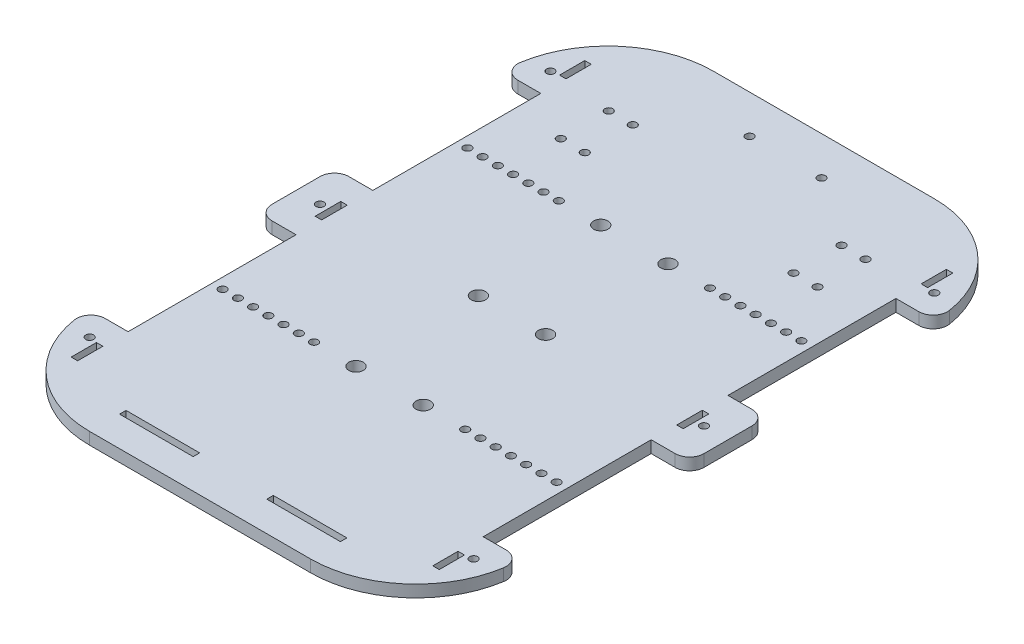
from build123d import *

# Parameters (mm, degrees)
SKETCH2_W           = 2.7
SKETCH2_H           = 10.51
SKETCH2_H_2         = 10.666666666
SKETCH2_W_2         = 30.68
SKETCH2_H_3         = 2.7
BOSS_EXTRUDE4_DEPTH = 5
SKETCH5_R           = 1.65
SKETCH5_R_2         = 3
CUT_EXTRUDE1_DEPTH  = 159.192920196


with BuildPart() as part:
    # Sketch2 → Boss-Extrude4 (new body)
    with BuildSketch(Plane(origin=(0, 0, 0), x_dir=(1, 0, 0), z_dir=(0, 1, 0))):
        with BuildLine():
            Line((46, -130), (-46, -130))
            ThreePointArc((-46, -130), (-74.550970119, -119.478980051), (-89.448061775, -92.947368421))
            ThreePointArc((-89.448061775, -92.947368421), (-88.08864154, -88.106685893), (-83.523326079, -86))
            Line((-83.523326079, -86), (-74, -86))
            Line((-74, -86), (-74, -16))
            Line((-74, -16), (-84, -16))
            ThreePointArc((-84, -16), (-88.242640687, -14.242640687), (-90, -10))
            Line((-90, -10), (-90, 10))
            ThreePointArc((-90, 10), (-88.242640687, 14.242640687), (-84, 16))
            Line((-84, 16), (-74, 16))
            Line((-74, 16), (-74, 86))
            Line((-74, 86), (-83.523326079, 86))
            ThreePointArc((-83.523326079, 86), (-88.08864154, 88.106685893), (-89.448061775, 92.947368421))
            ThreePointArc((-89.448061775, 92.947368421), (-74.550970119, 119.478980051), (-46, 130))
            Line((-46, 130), (46, 130))
            ThreePointArc((46, 130), (74.550970119, 119.478980051), (89.448061775, 92.947368421))
            ThreePointArc((89.448061775, 92.947368421), (88.08864154, 88.106685893), (83.523326079, 86))
            Line((83.523326079, 86), (74, 86))
            Line((74, 86), (74, 16))
            Line((74, 16), (84, 16))
            ThreePointArc((84, 16), (88.242640687, 14.242640687), (90, 10))
            Line((90, 10), (90, -10))
            ThreePointArc((90, -10), (88.242640687, -14.242640687), (84, -16))
            Line((84, -16), (74, -16))
            Line((74, -16), (74, -86))
            Line((74, -86), (83.523326079, -86))
            ThreePointArc((83.523326079, -86), (88.08864154, -88.106685893), (89.448061775, -92.947368421))
            ThreePointArc((89.448061775, -92.947368421), (74.550970119, -119.478980051), (46, -130))
        make_face()
        with Locations((-75.35, 101.765)):
            Rectangle(SKETCH2_W, SKETCH2_H, mode=Mode.SUBTRACT)
        with Locations((75.35, 101.765)):
            Rectangle(SKETCH2_W, SKETCH2_H, mode=Mode.SUBTRACT)
        with Locations((75.35, -101.765)):
            Rectangle(SKETCH2_W, SKETCH2_H, mode=Mode.SUBTRACT)
        with Locations((-75.35, -101.765)):
            Rectangle(SKETCH2_W, SKETCH2_H, mode=Mode.SUBTRACT)
        with Locations((-75.35, 0)):
            Rectangle(SKETCH2_W, SKETCH2_H_2, mode=Mode.SUBTRACT)
        with Locations((75.35, 0)):
            Rectangle(SKETCH2_W, SKETCH2_H_2, mode=Mode.SUBTRACT)
        with Locations((30.68, -116.18)):
            Rectangle(SKETCH2_W_2, SKETCH2_H_3, mode=Mode.SUBTRACT)
        with Locations((-30.68, -116.18)):
            Rectangle(SKETCH2_W_2, SKETCH2_H_3, mode=Mode.SUBTRACT)
    extrude(amount=BOSS_EXTRUDE4_DEPTH)

    # Sketch5 → Cut-Extrude1 (cut, through all)
    with BuildSketch(Plane(origin=(0, 5, 0), x_dir=(1, 0, 0), z_dir=(0, 1, 0))):
        with Locations((-69.6, -51)):
            Circle(SKETCH5_R)
        with Locations((-63.25, -51)):
            Circle(SKETCH5_R)
        with Locations((-56.9, -51)):
            Circle(SKETCH5_R)
        with Locations((-50.55, -51)):
            Circle(SKETCH5_R)
        with Locations((-44.2, -51)):
            Circle(SKETCH5_R)
        with Locations((-37.85, -51)):
            Circle(SKETCH5_R)
        with Locations((-31.5, -51)):
            Circle(SKETCH5_R)
        with Locations((31.5, -51)):
            Circle(SKETCH5_R)
        with Locations((37.85, -51)):
            Circle(SKETCH5_R)
        with Locations((44.2, -51)):
            Circle(SKETCH5_R)
        with Locations((50.55, -51)):
            Circle(SKETCH5_R)
        with Locations((56.9, -51)):
            Circle(SKETCH5_R)
        with Locations((63.25, -51)):
            Circle(SKETCH5_R)
        with Locations((69.6, -51)):
            Circle(SKETCH5_R)
        with Locations((69.6, 51)):
            Circle(SKETCH5_R)
        with Locations((63.25, 51)):
            Circle(SKETCH5_R)
        with Locations((56.9, 51)):
            Circle(SKETCH5_R)
        with Locations((50.55, 51)):
            Circle(SKETCH5_R)
        with Locations((44.2, 51)):
            Circle(SKETCH5_R)
        with Locations((37.85, 51)):
            Circle(SKETCH5_R)
        with Locations((31.5, 51)):
            Circle(SKETCH5_R)
        with Locations((-31.5, 51)):
            Circle(SKETCH5_R)
        with Locations((-37.85, 51)):
            Circle(SKETCH5_R)
        with Locations((-44.2, 51)):
            Circle(SKETCH5_R)
        with Locations((-50.55, 51)):
            Circle(SKETCH5_R)
        with Locations((-56.9, 51)):
            Circle(SKETCH5_R)
        with Locations((-63.25, 51)):
            Circle(SKETCH5_R)
        with Locations((-69.6, 51)):
            Circle(SKETCH5_R)
        with Locations((-14, -51)):
            Circle(SKETCH5_R_2)
        with Locations((14, -51)):
            Circle(SKETCH5_R_2)
        with Locations((14, 51)):
            Circle(SKETCH5_R_2)
        with Locations((-14, 51)):
            Circle(SKETCH5_R_2)
        with Locations((-14, 0)):
            Circle(SKETCH5_R_2)
        with Locations((14, 0)):
            Circle(SKETCH5_R_2)
        with Locations((-80, 96)):
            Circle(SKETCH5_R)
        with Locations((-80, 0)):
            Circle(SKETCH5_R)
        with Locations((80, 0)):
            Circle(SKETCH5_R)
        with Locations((-80, -96)):
            Circle(SKETCH5_R)
        with Locations((80, -96)):
            Circle(SKETCH5_R)
        with Locations((80, 96)):
            Circle(SKETCH5_R)
        with Locations((15, 114)):
            Circle(SKETCH5_R)
        with Locations((-15, 114)):
            Circle(SKETCH5_R)
        with Locations((-53.5, 93.83)):
            Circle(SKETCH5_R)
        with Locations((-53.5, 73.83)):
            Circle(SKETCH5_R)
        with Locations((-43.5, 73.83)):
            Circle(SKETCH5_R)
        with Locations((-43.5, 93.83)):
            Circle(SKETCH5_R)
        with Locations((43.5, 73.83)):
            Circle(SKETCH5_R)
        with Locations((53.5, 73.83)):
            Circle(SKETCH5_R)
        with Locations((43.5, 93.83)):
            Circle(SKETCH5_R)
        with Locations((53.5, 93.83)):
            Circle(SKETCH5_R)
    extrude(amount=-CUT_EXTRUDE1_DEPTH, mode=Mode.SUBTRACT)


solid = part.part
